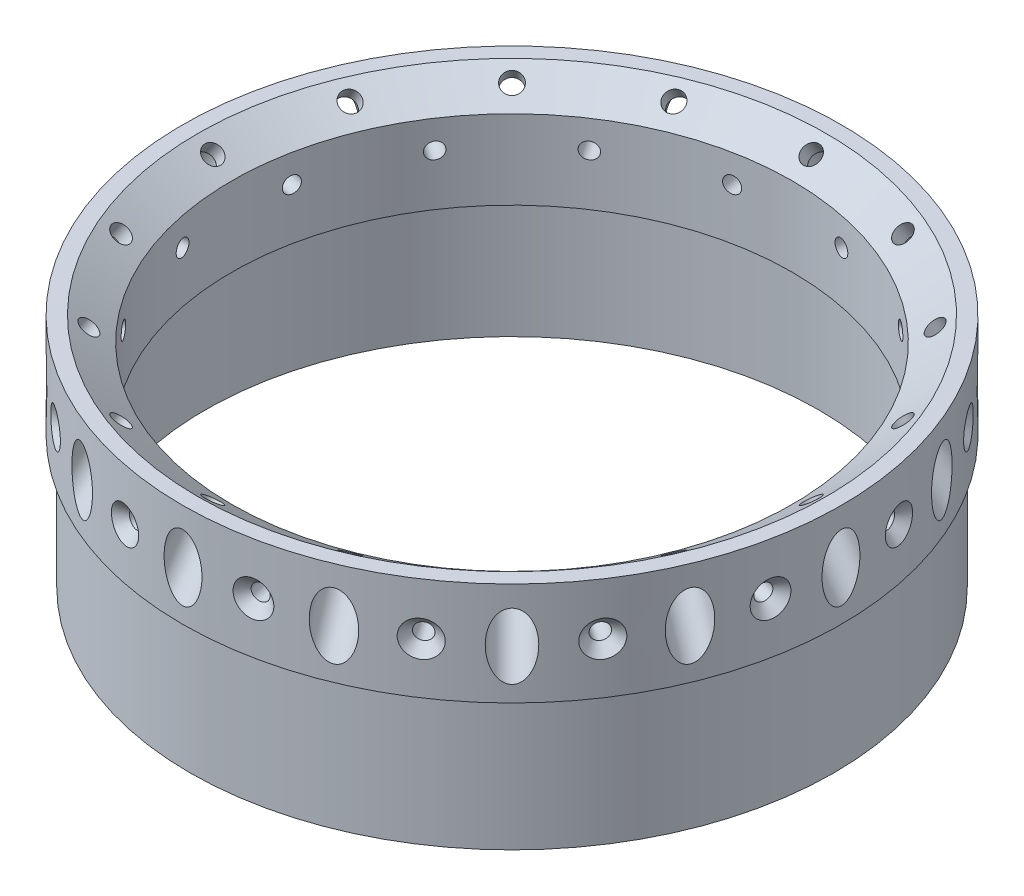
from build123d import *

# Parameters (mm, degrees)
HOLE_START                = -3
SKETCH14_R                = 5
HOLE_EXTRUDE_1_DEPTH      = 150.91522103
SCREW_EXTRUDE_D           = 5
SCREW_HOLES_PATTERN_COUNT = 16
SZYK_KO_OWY1_COUNT        = 16


# Read off the part's stored shape, not the designer's step: Pogłębienie stożkowe pod M4 wkręt do części metalowych z łbem soczewkowym1
with BuildPart() as part:
    # Main sketch → Main revolve (revolve)
    with BuildSketch(Plane.XY, mode=Mode.PRIVATE) as main_revolve_sk:
        Polygon((-85, -35), (-81, -35), (-81, 0), (-74, 0), (-74, 20.897302003), (-83, 27.199169847), (-87, 27.199169847), (-87, 0), (-85, 0), align=None)
    revolve(main_revolve_sk.sketch.rotate(Axis((0, 0, 0), (0, -1, 0)), 270), axis=Axis((0, 0, 0), (0, -1, 0)))

    # Sketch14 → Hole extrude 1 (cut)
    with BuildSketch(Plane(origin=(-18.526734454, -26.458918881, 0), x_dir=(0.8191520442889891, -0.5735764363510499, 0), z_dir=(-0.5735764363510499, -0.8191520442889891, 0)).offset(HOLE_START)):
        with Locations(Location((-78.707324234, 0, 0), (0, 0, 180))):
            Circle(SKETCH14_R)
    hole_extrude_1 = extrude(amount=HOLE_EXTRUDE_1_DEPTH, mode=Mode.SUBTRACT)

    # screw extrude (through all)
    with Locations(Plane(origin=(-81.279270691, 21.1432038, 0), x_dir=(-0.819152044289, 0.573576436351, 0), z_dir=(-0.573576436351, -0.819152044289, 0))):
        with Locations((0, 0)):
            screw_extrude = Hole(SCREW_EXTRUDE_D / 2)

    # Screw holes pattern: Hole extrude 1, screw extrude ×16 about axis
    screw_holes_pattern_axis = Axis((0, 0, 0), (0, 1, 0))
    add([hole_extrude_1.rotate(screw_holes_pattern_axis, i * 360 / SCREW_HOLES_PATTERN_COUNT) for i in range(1, SCREW_HOLES_PATTERN_COUNT)], mode=Mode.SUBTRACT)
    add([screw_extrude.rotate(screw_holes_pattern_axis, i * 360 / SCREW_HOLES_PATTERN_COUNT) for i in range(1, SCREW_HOLES_PATTERN_COUNT)], mode=Mode.SUBTRACT)

    # Pog_bienie sto_kowe pod M4 wkr_t do  2 → Pogłębienie stożkowe pod M4 wkręt do części metalowych z łbem soczewkowym1 (revolve, cut)
    with BuildSketch(Plane(origin=(0, 13.5, 0), x_dir=(0.9807852804032302, 0, -0.19509032201612905), z_dir=(0, -1, 0))):
        Polygon((0, 73.968743506), (2.15, 73.968743506), (2.15, 84.45), (4.70006513, 87.00006513), (0, 87.00006513), align=None)
    pog_bienie_sto_kowe_pod_m4_wkr_t_do_cz_c = revolve(axis=Axis((0, 13.5, 0), (0.19509032201612905, 0, 0.9807852804032302)), mode=Mode.SUBTRACT)

    # Szyk kołowy1: Pogłębienie stożkowe pod M4 wkręt do części metalowych z łbem soczewkowym1 ×16 about axis
    szyk_ko_owy1_axis = Axis((0, 0, 0), (0, 1, 0))
    for i in range(1, SZYK_KO_OWY1_COUNT):
        add(pog_bienie_sto_kowe_pod_m4_wkr_t_do_cz_c.rotate(szyk_ko_owy1_axis, i * 360 / SZYK_KO_OWY1_COUNT), mode=Mode.SUBTRACT)


solid = part.part
